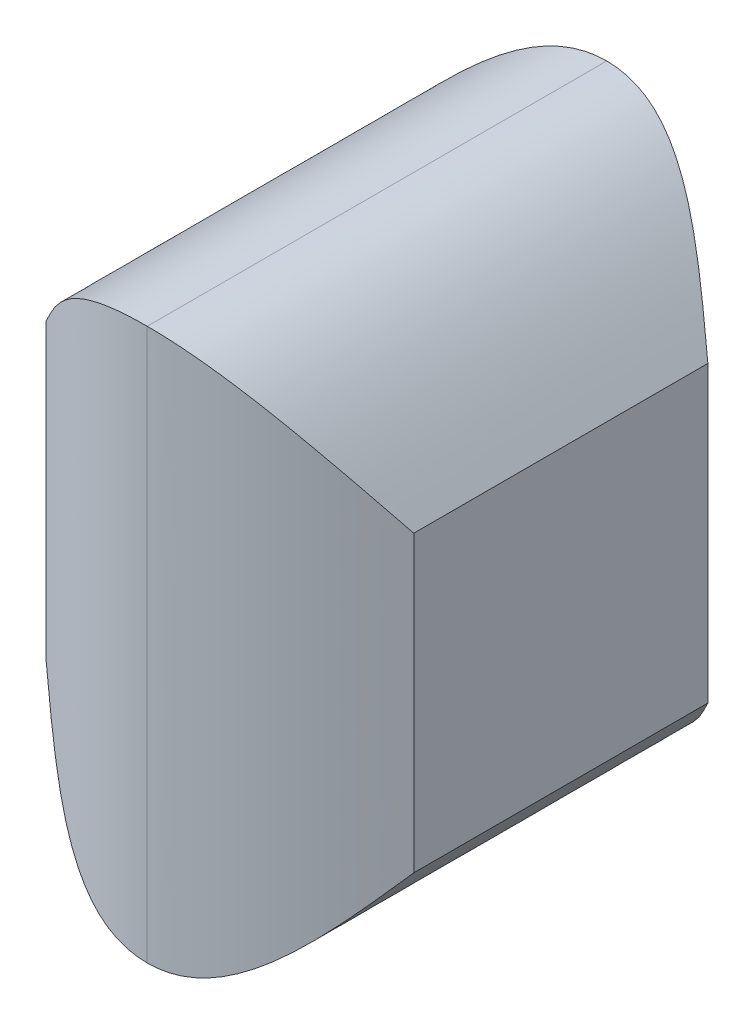
from build123d import *

# Parameters (mm, degrees)
LOFT1_START   = -102.5
LOFT1_DEPTH   = 79.9999999
LOFT1_START_2 = -1e-07
LOFT1_2_DEPTH = 150.0000001
LOFT1_START_3 = -126
LOFT1_3_DEPTH = 127


with BuildPart() as part:
    # Loft1: read off the stored shape, not the designer's step
    # Loft1 outline → Loft1 (new body)
    with BuildSketch(Plane.XY.offset(LOFT1_START)):
        with BuildLine():
            add(Edge.make_bspline(
                [(300, 35), (314.158656807, 17.5), (328.317313615, 0), (350, 0)],
                knots=[0, 0, 0, 0, 1, 1, 1, 1], degree=3))
            Line((350, 0), (350, 150))
            add(Edge.make_bspline(
                [(300, 115), (314.158656807, 132.5), (328.317313615, 150), (350, 150)],
                knots=[0, 0, 0, 0, 1, 1, 1, 1], degree=3))
            Line((300, 115), (300, 35))
        make_face()
    loft1 = extrude(amount=LOFT1_DEPTH)

    # Loft1 2 outline → Loft1 2 (add)
    with BuildSketch(Plane(origin=(0, 0, 0), x_dir=(1, 0, 0), z_dir=(0, 1, 0)).offset(LOFT1_START_2)):
        with BuildLine():
            Line((350, 22.5000001), (300, 22.5))
            add(Edge.make_bspline(
                [(300, 22.5), (314.158656807, 11.25), (328.317313615, 0), (350, 0)],
                knots=[0, 0, 0, 0, 1, 1, 1, 1], degree=3))
            Line((350, 0), (350, 22.5000001))
        make_face()
        with BuildLine():
            Line((300, 102.5), (350, 102.5))
            Line((350, 102.5), (350, 125))
            add(Edge.make_bspline(
                [(300, 102.5), (314.158656807, 113.75), (328.317313615, 125), (350, 125)],
                knots=[0, 0, 0, 0, 1, 1, 1, 1], degree=3))
        make_face()
    loft1_2 = extrude(amount=LOFT1_2_DEPTH)

    # Loft1 3 outline → Loft1 3 (cut)
    with BuildSketch(Plane.XY.offset(LOFT1_START_3)):
        with BuildLine():
            Line((300, 35), (300, -1e-07))
            Line((300, -1e-07), (350, 0))
            add(Edge.make_bspline(
                [(300, 35), (314.158656807, 17.5), (328.317313615, 0), (350, 0)],
                knots=[0, 0, 0, 0, 1, 1, 1, 1], degree=3))
        make_face()
        with BuildLine():
            Line((300, 150), (300, 115))
            add(Edge.make_bspline(
                [(300, 115), (314.158656807, 132.5), (328.317313615, 150), (350, 150)],
                knots=[0, 0, 0, 0, 1, 1, 1, 1], degree=3))
            Line((350, 150), (300, 150))
        make_face()
    loft1_3 = extrude(amount=LOFT1_3_DEPTH, mode=Mode.SUBTRACT)

    # Mirror1: Loft1, Loft1 2, Loft1 3 across plane
    add(loft1.mirror(Plane(origin=(350, 0, 0), x_dir=(0, 0, 1), z_dir=(1, 0, 0))))
    add(loft1_2.mirror(Plane(origin=(350, 0, 0), x_dir=(0, 0, 1), z_dir=(1, 0, 0))))
    add(loft1_3.mirror(Plane(origin=(350, 0, 0), x_dir=(0, 0, 1), z_dir=(1, 0, 0))), mode=Mode.SUBTRACT)


solid = part.part
